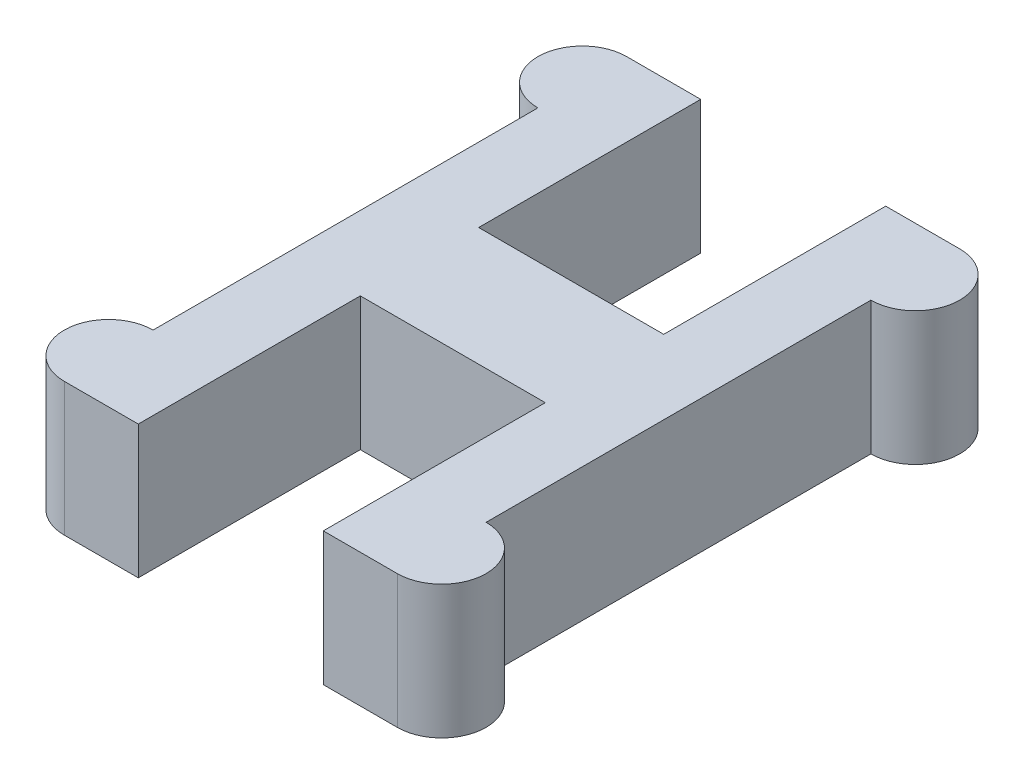
from build123d import *

# Parameters (mm, degrees)
BOSS_EXTRUDE1_DEPTH = 1.8


with BuildPart() as part:
    # Sketch1 → Boss-Extrude1 (new body)
    with BuildSketch(Plane(origin=(0, 0, 0), x_dir=(1, 0, 0), z_dir=(0, 1, 0))):
        with BuildLine():
            Line((-1.25, -3.8), (-1.25, -0.8))
            Line((-1.25, -0.8), (1.25, -0.8))
            Line((1.25, -0.8), (1.25, -3.8))
            Line((1.25, -3.8), (2.25, -3.8))
            ThreePointArc((2.25, -3.8), (2.85, -3.2), (2.25, -2.6))
            Line((2.25, -2.6), (2.25, 2.6))
            ThreePointArc((2.25, 2.6), (2.85, 3.2), (2.25, 3.8))
            Line((2.25, 3.8), (1.25, 3.8))
            Line((1.25, 3.8), (1.25, 0.8))
            Line((1.25, 0.8), (-1.25, 0.8))
            Line((-1.25, 0.8), (-1.25, 3.8))
            Line((-1.25, 3.8), (-2.25, 3.8))
            ThreePointArc((-2.25, 3.8), (-2.85, 3.2), (-2.25, 2.6))
            Line((-2.25, 2.6), (-2.25, -2.6))
            ThreePointArc((-2.25, -2.6), (-2.85, -3.2), (-2.25, -3.8))
            Line((-2.25, -3.8), (-1.25, -3.8))
        make_face()
    extrude(amount=BOSS_EXTRUDE1_DEPTH)


solid = part.part
